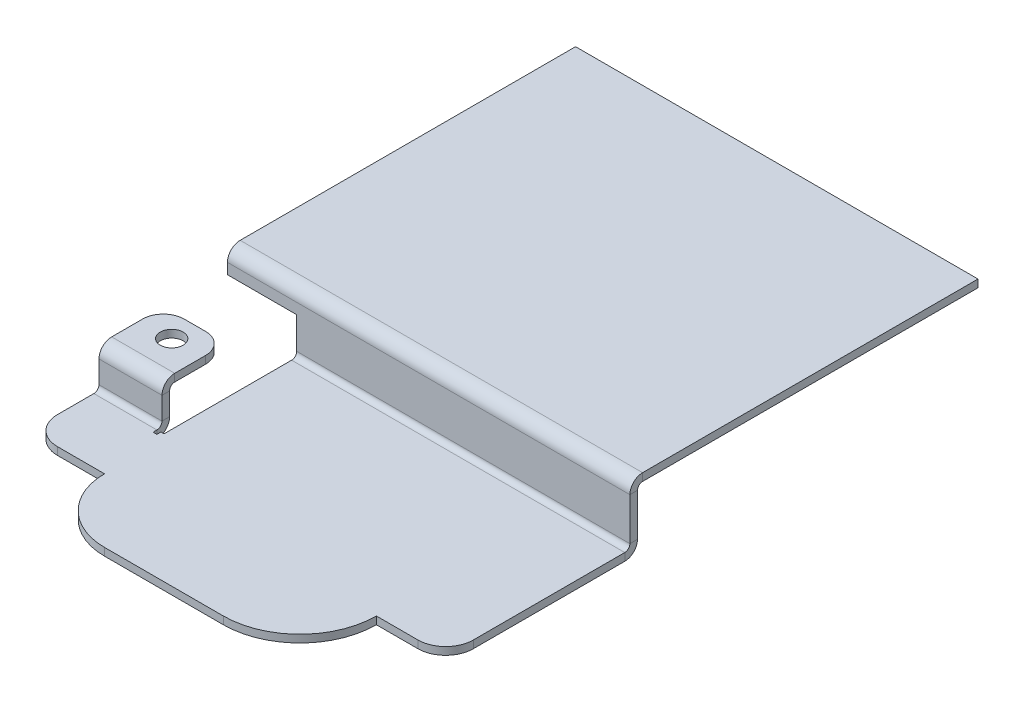
from build123d import *

# Parameters (mm, degrees)
BASE_FLANGE1_DEPTH            = 1.1
EDGE_FLANGE1_STRIP_W          = 5.8732
EDGE_FLANGE1_STRIP_H          = 1.1
EDGE_FLANGE1_STRIP_CUT_DEPTH  = 9.1
EDGE_FLANGE1_RELIEF_W         = 6.4232
EDGE_FLANGE1_RELIEF_H         = 0.55
EDGE_FLANGE1_RELIEF_CUT_DEPTH = 1.1
EDGE_FLANGE1_DEPTH            = 9.1
EDGE_FLANGE2_STRIP_W          = 5.8732
EDGE_FLANGE2_STRIP_H          = 1.1
EDGE_FLANGE2_STRIP_CUT_DEPTH  = 9.1
EDGE_FLANGE2_DEPTH            = 9.1
SKETCH9_R                     = 1.65
EXTRUDE1_DEPTH                = 1.1
SKETCHED_START                = -30
SKETCHED_BEND2_DEPTH          = 58.1
SKETCHED_BEND2_2_OUTLINE_W    = 51.994658845
SKETCHED_BEND2_2_OUTLINE_H    = 1.1
SKETCHED_BEND2_2_DEPTH        = 58.1
SKETCHED_START_2              = -20
SKETCHED_BEND2_3_DEPTH        = 48.1
SKETCHED_BEND6_DEPTH          = 58.1
SKETCHED_BEND6_2_DEPTH        = 58.1


# Read off the part's stored shape, not the designer's step: Sketched Bend2, Sketched Bend6
# Sheet-metal steps are written as plain solids
with BuildPart() as part:
    # Sketch1 → Base-Flange1 (new body)
    with BuildSketch(Plane(origin=(0, 0, 0), x_dir=(1, 0, 0), z_dir=(0, 1, 0))):
        with BuildLine():
            Line((-30.1, 1.2), (-21, 1.2))
            Line((-21, 1.2), (-21, -0.6))
            Line((-21, -0.6), (-20, -0.6))
            Line((-20, -0.6), (-20, 24.411105723))
            Line((-20, 24.411105723), (-30, 24.411105723))
            Line((-30, 24.411105723), (-30, 76.405764568))
            Line((-30, 76.405764568), (28.1, 76.405764568))
            Line((28.1, 76.405764568), (28.1, 19.7))
            Line((28.1, 19.7), (28.1, -4.05))
            ThreePointArc((28.1, -4.05), (26.928427125, -6.878427125), (24.1, -8.05))
            Line((24.1, -8.05), (18.1, -8.05))
            ThreePointArc((18.1, -8.05), (14.863529932, -15.863529932), (7.05, -19.1))
            Line((7.05, -19.1), (-10.1, -19.1))
            ThreePointArc((-10.1, -19.1), (-16.605382387, -16.405382387), (-19.3, -9.9))
            Line((-19.3, -9.9), (-26.1, -9.9))
            ThreePointArc((-26.1, -9.9), (-28.928427125, -8.728427125), (-30.1, -5.9))
            Line((-30.1, -5.9), (-30.1, 1.2))
        make_face()
    extrude(amount=BASE_FLANGE1_DEPTH)

    # Edge-Flange1 strip (across the edge) → Edge-Flange1 strip cut (cut)
    with BuildSketch(Plane(origin=(-21, 1.1, -1.2), x_dir=(0, 0, 1), z_dir=(-1, 0, 0))):
        with Locations((-1.1, -0.55)):
            Rectangle(EDGE_FLANGE1_STRIP_W, EDGE_FLANGE1_STRIP_H)
    extrude(amount=EDGE_FLANGE1_STRIP_CUT_DEPTH, mode=Mode.SUBTRACT)

    # Edge-Flange1 relief (on the sheet) → Edge-Flange1 relief cut (cut)
    with BuildSketch(Plane(origin=(-21, 1.1, 0.6366), x_dir=(0, 0, 1), z_dir=(0, 1, 0))):
        with Locations((-2.6616, 0.275)):
            Rectangle(EDGE_FLANGE1_RELIEF_W, EDGE_FLANGE1_RELIEF_H)
    extrude(amount=-EDGE_FLANGE1_RELIEF_CUT_DEPTH, mode=Mode.SUBTRACT)

    # Edge-Flange1 section (across the edge) → Edge-Flange1 (add)
    with BuildSketch(Plane(origin=(-21, 1.1, -1.2), x_dir=(0, 0, 1), z_dir=(-1, 0, 0))):
        with BuildLine():
            Line((0, 0.7366), (0, 5.8))
            Line((0, 5.8), (1.1, 5.8))
            Line((1.1, 5.8), (1.1, 0.7366))
            ThreePointArc((1.1, 0.7366), (1.315745145, 0.215745145), (1.8366, 0))
            Line((1.8366, 0), (1.8366, -1.1))
            ThreePointArc((1.8366, -1.1), (0.537927686, -0.562072314), (0, 0.7366))
        make_face()
    extrude(amount=EDGE_FLANGE1_DEPTH)

    # Edge-Flange2 strip (across the edge) → Edge-Flange2 strip cut (cut)
    with BuildSketch(Plane(origin=(-30.1, 6.9, -1.2), x_dir=(0, -1, 0), z_dir=(1, 0, 0))):
        with Locations((-1.1, -0.55)):
            Rectangle(EDGE_FLANGE2_STRIP_W, EDGE_FLANGE2_STRIP_H)
    extrude(amount=EDGE_FLANGE2_STRIP_CUT_DEPTH, mode=Mode.SUBTRACT)

    # Edge-Flange2 section (across the edge) → Edge-Flange2 (add)
    with BuildSketch(Plane(origin=(-30.1, 6.9, -1.2), x_dir=(0, -1, 0), z_dir=(1, 0, 0))):
        with BuildLine():
            Line((0, 0.7366), (0, 8.2))
            Line((0, 8.2), (1.1, 8.2))
            Line((1.1, 8.2), (1.1, 0.7366))
            ThreePointArc((1.1, 0.7366), (1.315745145, 0.215745145), (1.8366, 0))
            Line((1.8366, 0), (1.8366, -1.1))
            ThreePointArc((1.8366, -1.1), (0.537927686, -0.562072314), (0, 0.7366))
        make_face()
    extrude(amount=EDGE_FLANGE2_DEPTH)

    # Sketch9 → Extrude1 (cut)
    with BuildSketch(Plane(origin=(0, 6.9, 0), x_dir=(1, 0, 0), z_dir=(0, 1, 0))):
        with Locations(Location((-25.55, 6.05, 0), (0, 0, 270))):
            Circle(SKETCH9_R)
        with BuildLine():
            Line((-30.1, 6.4), (-30.1, 9.4))
            Line((-30.1, 9.4), (-27.1, 9.4))
            ThreePointArc((-27.1, 9.4), (-29.221320344, 8.521320344), (-30.1, 6.4))
        make_face()
        with BuildLine():
            Line((-24, 9.4), (-21, 9.4))
            Line((-21, 9.4), (-21, 6.4))
            ThreePointArc((-21, 6.4), (-21.878679656, 8.521320344), (-24, 9.4))
        make_face()
    extrude(amount=-EXTRUDE1_DEPTH, mode=Mode.SUBTRACT)

    # Sketched Bend2 outline → Sketched Bend2 (cut)
    with BuildSketch(Plane.YZ.offset(SKETCHED_START)):
        with BuildLine():
            ThreePointArc((1.1, -19.495814944), (0.299404636, -18.818452246), (-1.2e-08, -17.8134))
            Line((-1.2e-08, -17.8134), (0, -76.405764568))
            Line((0, -76.405764568), (1.1, -76.405764568))
            Line((1.1, -76.405764568), (1.1, -19.495814944))
        make_face()
    extrude(amount=SKETCHED_BEND2_DEPTH, mode=Mode.SUBTRACT)



with BuildPart() as body_2:
    # Sketched Bend2 2 outline → Sketched Bend2 2 (new body)
    with BuildSketch(Plane.YZ.offset(SKETCHED_START)):
        with Locations((32.410648591, -19.1)):
            Rectangle(SKETCHED_BEND2_2_OUTLINE_W, SKETCHED_BEND2_2_OUTLINE_H)
    extrude(amount=SKETCHED_BEND2_2_DEPTH)


with BuildPart() as part_1:
    add(part.part)

    add(body_2.part)  # Sketched Bend2 3 merges body 2
    # Sketched Bend2 3 outline → Sketched Bend2 3 (add)
    with BuildSketch(Plane.YZ.offset(SKETCHED_START_2)):
        with BuildLine():
            Line((6.413319169, -18.55), (1.836600012, -18.550000012))
            ThreePointArc((1.836600012, -18.550000012), (1.315745141, -18.334254868), (1.099999988, -17.8134))
            Line((1.099999988, -17.8134), (1.1, -19.495814944))
            ThreePointArc((1.1, -19.495814944), (1.460317993, -19.611040525), (1.8366, -19.650000012))
            Line((1.8366, -19.650000012), (6.413319169, -19.65))
            Line((6.413319169, -19.65), (6.413319169, -18.55))
        make_face()
    extrude(amount=SKETCHED_BEND2_3_DEPTH)

    # Sketched Bend6 outline → Sketched Bend6 (cut)
    with BuildSketch(Plane.YZ.offset(SKETCHED_START)):
        with BuildLine():
            Line((58.407978014, -18.55), (7.9634, -18.549999994))
            ThreePointArc((7.9634, -18.549999994), (8.968452241, -18.849404641), (9.645814937, -19.65))
            Line((9.645814937, -19.65), (58.407978014, -19.65))
            Line((58.407978014, -19.65), (58.407978014, -18.55))
        make_face()
    extrude(amount=SKETCHED_BEND6_DEPTH, mode=Mode.SUBTRACT)

    # Sketched Bend6 2 outline → Sketched Bend6 2 (add)
    with BuildSketch(Plane.YZ.offset(SKETCHED_START)):
        with BuildLine():
            ThreePointArc((9.800000006, -20.3866), (9.761040518, -20.010317993), (9.645814937, -19.65))
            Line((9.645814937, -19.65), (7.9634, -19.649999994))
            ThreePointArc((7.9634, -19.649999994), (8.484254859, -19.865745141), (8.700000006, -20.3866))
            Line((8.700000006, -20.3866), (8.7, -68.81019146))
            Line((8.7, -68.81019146), (9.8, -68.81019146))
            Line((9.8, -68.81019146), (9.800000006, -20.3866))
        make_face()
    extrude(amount=SKETCHED_BEND6_2_DEPTH)


solid = part_1.part
